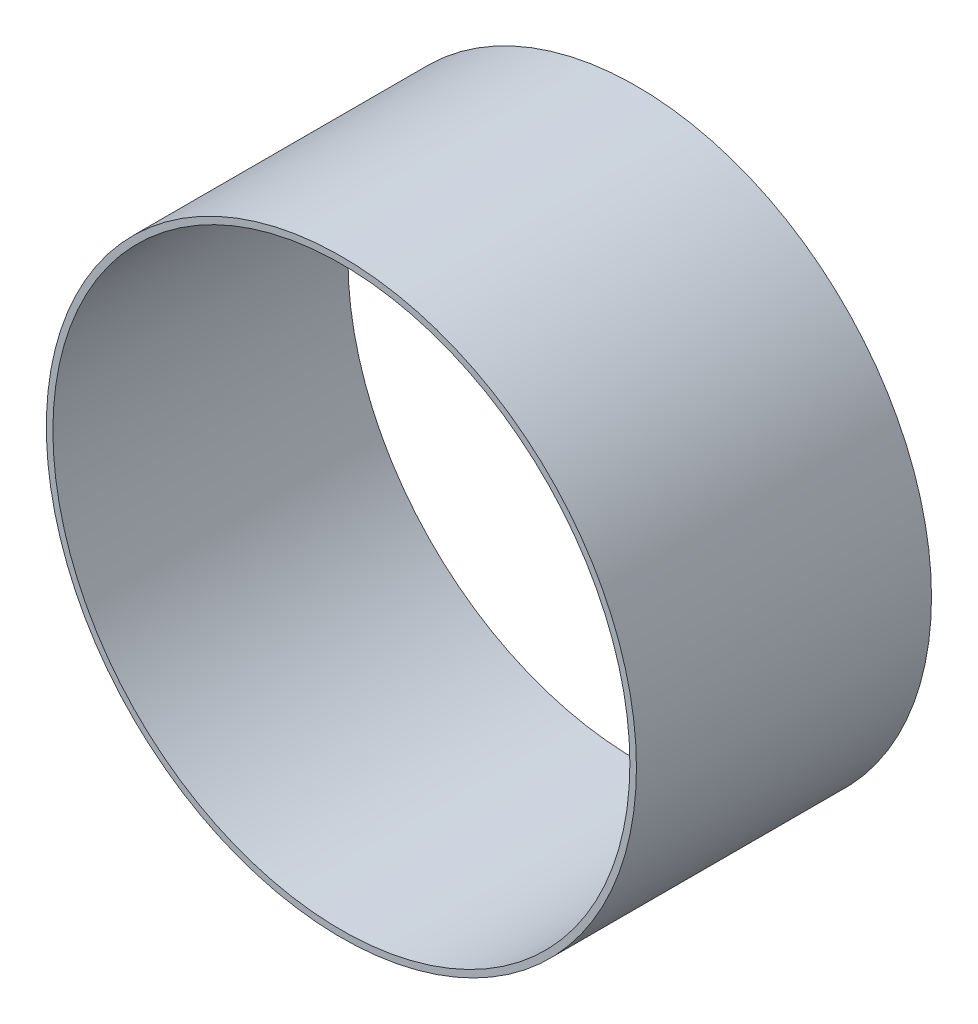
from build123d import *

# Parameters (mm, degrees)
SKETCH1_R           = 50.8
SKETCH1_R_2         = 49.6697
BOSS_EXTRUDE1_DEPTH = 50.8


with BuildPart() as part:
    # Sketch1 → Boss-Extrude1 (new body)
    with BuildSketch(Plane.XY):
        Circle(SKETCH1_R)
        Circle(SKETCH1_R_2, mode=Mode.SUBTRACT)
    extrude(amount=BOSS_EXTRUDE1_DEPTH)


solid = part.part
